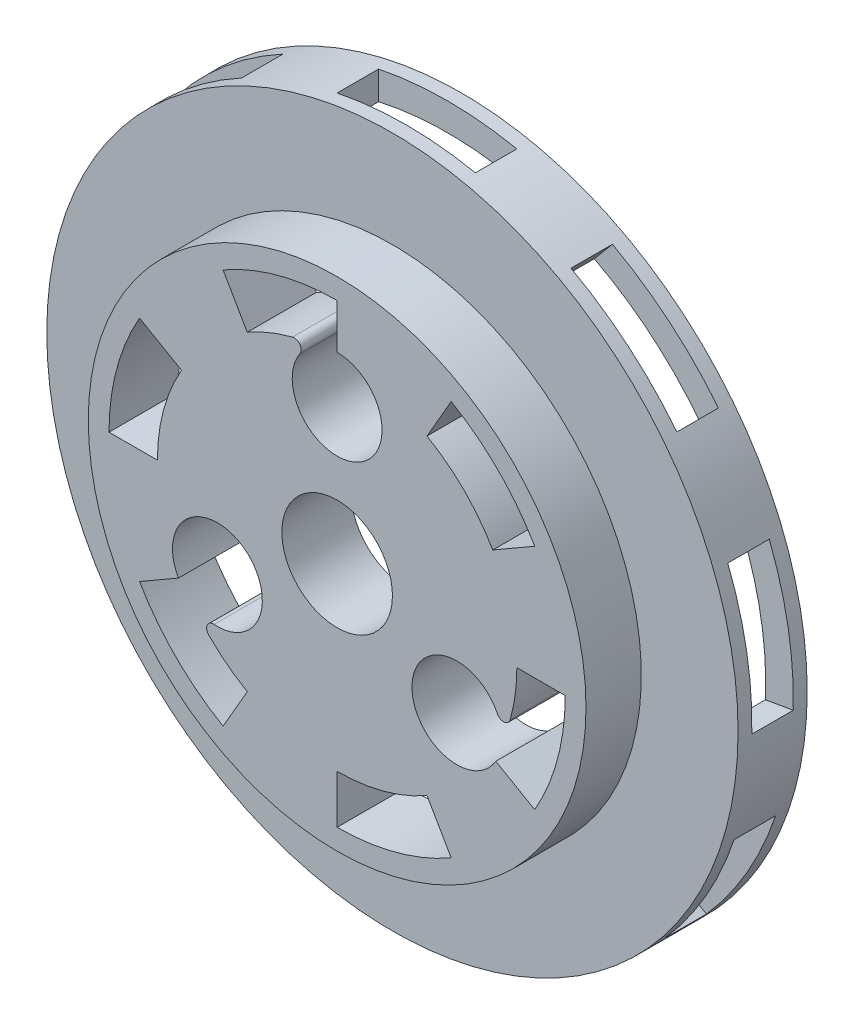
from build123d import *

# Parameters (mm, degrees)
ESQUISSE1_R                  = 18
BOSS_EXTRU_1_DEPTH           = 4
ESQUISSE5_R                  = 25
BOSS_EXTRU_2_DEPTH           = 1
ENL_V_MAT_EXTRU_1_DEPTH      = 36.707142143
ESQUISSE4_R                  = 4
ENL_V_MAT_EXTRU_3_DEPTH      = 36.707142143
R_P_TITION_CIRCULAIRE1_COUNT = 6
ESQUISSE3_R                  = 3.25
ENL_V_MAT_EXTRU_2_DEPTH      = 36.707142143
R_P_TITION_CIRCULAIRE2_COUNT = 3
CONG_1_R                     = 0.5
ESQUISSE6_R                  = 25
ESQUISSE6_R_2                = 23
BOSS_EXTRU_3_DEPTH           = 4
ESQUISSE7_W                  = 10
ESQUISSE7_H                  = 3
ENL_V_MAT_EXTRU_4_DEPTH      = 4
R_P_TITION_CIRCULAIRE3_COUNT = 9


with BuildPart() as part:
    # Esquisse1 → Boss.-Extru.1 (new body)
    with BuildSketch(Plane.XY):
        Circle(ESQUISSE1_R)
    extrude(amount=BOSS_EXTRU_1_DEPTH)

    # Esquisse5 → Boss.-Extru.2 (add)
    with BuildSketch(Plane(origin=(0, 0, 0), x_dir=(-1, 0, 0), z_dir=(0, 0, -1))):
        Circle(ESQUISSE5_R)
    extrude(amount=BOSS_EXTRU_2_DEPTH)

    # Esquisse2 → Enlèv. mat.-Extru.1 (cut, through all)
    with BuildSketch(Plane.XY.offset(4)):
        with BuildLine():
            Line((0, 13), (0, 16.5))
            ThreePointArc((0, 16.5), (-4.270514244, 15.937776134), (-8.25, 14.289419162))
            Line((-8.25, 14.289419162), (-6.5, 11.258330249))
            ThreePointArc((-6.5, 11.258330249), (-3.364647586, 12.557035742), (0, 13))
        make_face()
    enl_v_mat_extru_1 = extrude(amount=-ENL_V_MAT_EXTRU_1_DEPTH, mode=Mode.SUBTRACT)

    # Esquisse4 → Enlèv. mat.-Extru.3 (cut, through all)
    with BuildSketch(Plane.XY.offset(4)):
        Circle(ESQUISSE4_R)
    extrude(amount=-ENL_V_MAT_EXTRU_3_DEPTH, mode=Mode.SUBTRACT)

    # Répétition circulaire1: Enlèv. mat.-Extru.1 ×6 about axis
    r_p_tition_circulaire1_axis = Axis((0, 0, 4), (0, 0, 1))
    for i in range(1, R_P_TITION_CIRCULAIRE1_COUNT):
        add(enl_v_mat_extru_1.rotate(r_p_tition_circulaire1_axis, i * 360 / R_P_TITION_CIRCULAIRE1_COUNT), mode=Mode.SUBTRACT)

    # Esquisse3 → Enlèv. mat.-Extru.2 (cut, through all)
    with BuildSketch(Plane.XY.offset(4)):
        with Locations((0, 10)):
            Circle(ESQUISSE3_R)
    enl_v_mat_extru_2 = extrude(amount=-ENL_V_MAT_EXTRU_2_DEPTH, mode=Mode.SUBTRACT)

    # Répétition circulaire2: Enlèv. mat.-Extru.2 ×3 about axis
    r_p_tition_circulaire2_axis = Axis((0, 0, 4), (0, 0, 1))
    for i in range(1, R_P_TITION_CIRCULAIRE2_COUNT):
        add(enl_v_mat_extru_2.rotate(r_p_tition_circulaire2_axis, i * 360 / R_P_TITION_CIRCULAIRE2_COUNT), mode=Mode.SUBTRACT)

    # Congé1
    cong_1_edges = [part.edges().sort_by_distance(p)[0] for p in [
        (11.902210222, -5.228517173, 1.5),
        (-10.479133807, -7.693357827, 1.5),
        (-1.423076416, 12.921875, 1.5),
    ]]
    fillet(cong_1_edges, radius=CONG_1_R)

    # Esquisse6 → Boss.-Extru.3 (add)
    with BuildSketch(Plane(origin=(0, 0, -1), x_dir=(-1, 0, 0), z_dir=(0, 0, -1))):
        Circle(ESQUISSE6_R)
        Circle(ESQUISSE6_R_2, mode=Mode.SUBTRACT)
    extrude(amount=BOSS_EXTRU_3_DEPTH)

    # Esquisse7 → Enlèv. mat.-Extru.4 (cut)
    with BuildSketch(Plane(origin=(0, 25, 0), x_dir=(1, 0, 0), z_dir=(0, 1, 0))):
        with Locations((0, 2.5)):
            Rectangle(ESQUISSE7_W, ESQUISSE7_H)
    enl_v_mat_extru_4 = extrude(amount=-ENL_V_MAT_EXTRU_4_DEPTH, mode=Mode.SUBTRACT)

    # Répétition circulaire3: Enlèv. mat.-Extru.4 ×9 about axis
    r_p_tition_circulaire3_axis = Axis((0, 0, -1), (0, 0, 1))
    for i in range(1, R_P_TITION_CIRCULAIRE3_COUNT):
        add(enl_v_mat_extru_4.rotate(r_p_tition_circulaire3_axis, i * 360 / R_P_TITION_CIRCULAIRE3_COUNT), mode=Mode.SUBTRACT)


solid = part.part
